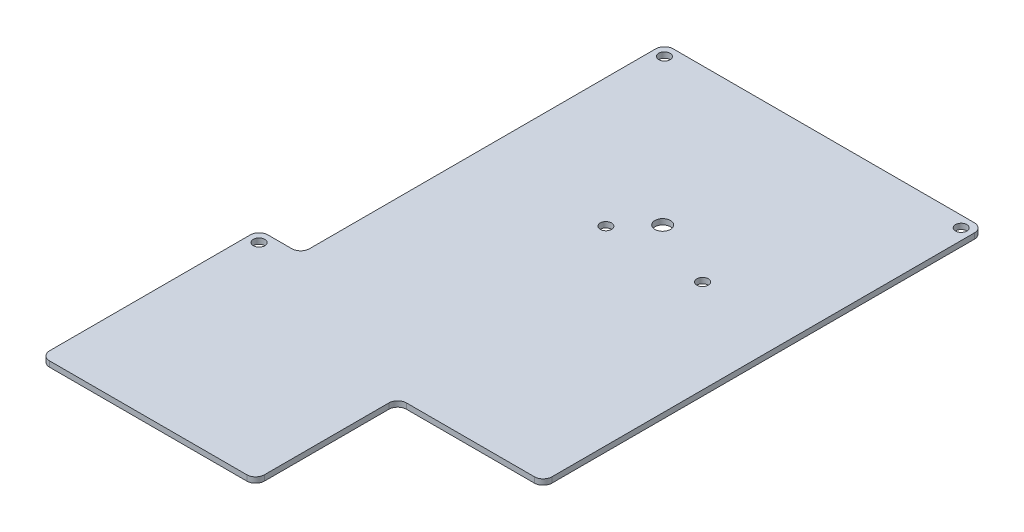
from build123d import *

# Parameters (mm, degrees)
SKETCH1_W                 = 92
SKETCH1_H                 = 127
BOSS_EXTRUDE1_DEPTH       = 1.6
F_4_CLEARANCE_HOLE1_D     = 3.2639
F_4_CLEARANCE_HOLE1_DEPTH = 18.75
F_4_CLEARANCE_HOLE1_TIP   = 0.980574487
F_8_CLEARANCE_HOLE1_D     = 4.4958
F_8_CLEARANCE_HOLE1_DEPTH = 18.75
F_8_CLEARANCE_HOLE1_TIP   = 1.350674586
SKETCH8_W                 = 62
SKETCH8_H                 = 63
BOSS_EXTRUDE2_DEPTH       = 1.6
F_4_CLEARANCE_HOLE2_D     = 3.2639
F_4_CLEARANCE_HOLE2_DEPTH = 50
F_4_CLEARANCE_HOLE2_TIP   = 0.980574487
FILLET1_R                 = 2.54


with BuildPart() as part:
    # Sketch1 → Boss-Extrude1 (new body)
    with BuildSketch(Plane(origin=(0, 0, 0), x_dir=(1, 0, 0), z_dir=(0, 1, 0))):
        Rectangle(SKETCH1_W, SKETCH1_H)
    extrude(amount=BOSS_EXTRUDE1_DEPTH)

    # #4 Clearance Hole1
    with Locations(Plane(origin=(0, 1.6, 0), x_dir=(1, 0, 0), z_dir=(0, 1, 0))):
        with Locations((19.05, 9.46), (-8.85, 9.46)):
            Hole(F_4_CLEARANCE_HOLE1_D / 2, depth=F_4_CLEARANCE_HOLE1_DEPTH)
            with Locations((0, 0, -(F_4_CLEARANCE_HOLE1_DEPTH + F_4_CLEARANCE_HOLE1_TIP / 2))):  # 118° drill point
                Cone(0, F_4_CLEARANCE_HOLE1_D / 2, F_4_CLEARANCE_HOLE1_TIP, mode=Mode.SUBTRACT)

    # #8 Clearance Hole1
    with Locations(Plane(origin=(0, 0, 0), x_dir=(-1, 0, 0), z_dir=(0, -1, 0))):
        with Locations((0.967601314, 17.964663054)):
            Hole(F_8_CLEARANCE_HOLE1_D / 2, depth=F_8_CLEARANCE_HOLE1_DEPTH)
            with Locations((0, 0, -(F_8_CLEARANCE_HOLE1_DEPTH + F_8_CLEARANCE_HOLE1_TIP / 2))):  # 118° drill point
                Cone(0, F_8_CLEARANCE_HOLE1_D / 2, F_8_CLEARANCE_HOLE1_TIP, mode=Mode.SUBTRACT)

    # Sketch8 → Boss-Extrude2 (add)
    with BuildSketch(Plane(origin=(0, 0, 0), x_dir=(1, 0, 0), z_dir=(0, 1, 0))):
        with Locations((-27, -73)):
            Rectangle(SKETCH8_W, SKETCH8_H)
    extrude(amount=BOSS_EXTRUDE2_DEPTH)

    # #4 Clearance Hole2
    with Locations(Plane(origin=(0, 1.6, 0), x_dir=(1, 0, 0), z_dir=(0, 1, 0))):
        with Locations((-42.825, 60.325), (42.825, 60.325), (-54.82, -44.68)):
            Hole(F_4_CLEARANCE_HOLE2_D / 2, depth=F_4_CLEARANCE_HOLE2_DEPTH)
            with Locations((0, 0, -(F_4_CLEARANCE_HOLE2_DEPTH + F_4_CLEARANCE_HOLE2_TIP / 2))):  # 118° drill point
                Cone(0, F_4_CLEARANCE_HOLE2_D / 2, F_4_CLEARANCE_HOLE2_TIP, mode=Mode.SUBTRACT)

    # Fillet1
    fillet1_edges = [part.edges().sort_by_distance(p)[0] for p in [
        (46, 0.8, 63.5),
        (46, 0.8, -63.5),
        (-46, 0.8, -63.5),
        (4, 0.8, 63.5),
        (4, 0.8, 104.5),
        (-58, 0.8, 104.5),
        (-58, 0.8, 41.5),
        (-46, 0.8, 41.5),
    ]]
    fillet(fillet1_edges, radius=FILLET1_R)


solid = part.part
